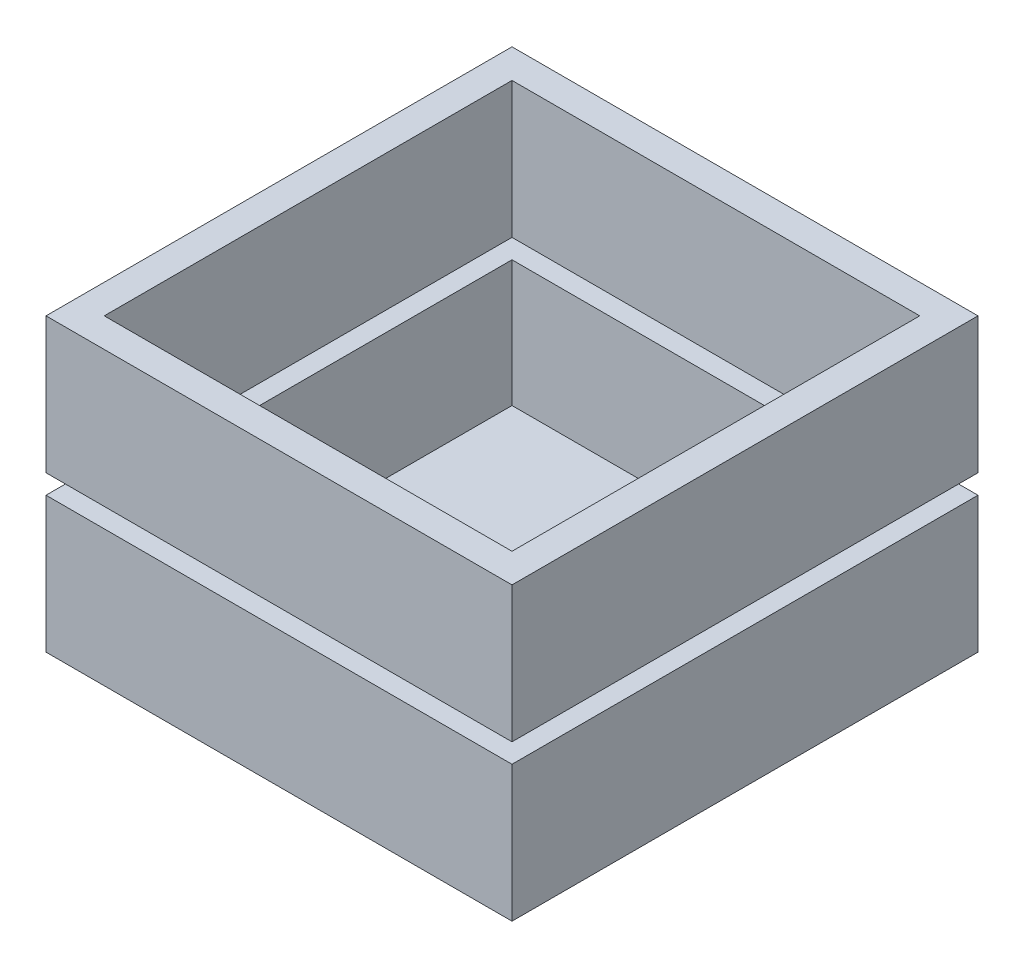
from build123d import *

# Parameters (mm, degrees)
SKETCH1_W           = 304.8
SKETCH1_H           = 304.8
BOSS_EXTRUDE1_DEPTH = 203.2
SHELL1_T            = -19.05
SKETCH2_W           = 304.8
SKETCH2_H           = 12.7
CUT_EXTRUDE1_DEPTH  = 397.760683536


with BuildPart() as part:
    # Sketch1 → Boss-Extrude1 (new body)
    with BuildSketch(Plane(origin=(0, 0, 0), x_dir=(1, 0, 0), z_dir=(0, 1, 0))):
        Rectangle(SKETCH1_W, SKETCH1_H)
    extrude(amount=BOSS_EXTRUDE1_DEPTH)

    # Shell1
    shell1_openings = [part.faces().sort_by_distance(p)[0] for p in [
        (0, 203.2, 0),
    ]]
    offset(amount=SHELL1_T, openings=shell1_openings, kind=Kind.INTERSECTION)

    # Sketch2 → Cut-Extrude1 (cut, through all)
    with BuildSketch(Plane.XY.offset(152.4)):
        with Locations((0, 107.95)):
            Rectangle(SKETCH2_W, SKETCH2_H)
        with Locations((0, 6.35)):
            Rectangle(SKETCH2_W, SKETCH2_H)
    extrude(amount=-CUT_EXTRUDE1_DEPTH, mode=Mode.SUBTRACT)


with BuildPart() as cut_extrude1_piece_1:
    # of the separate pieces the step leaves, piece 1, a body of its own (cut_extrude1_pieces)
    add(part.part.solids().sort_by_distance((152.4, 12.7, -152.4))[0])


with BuildPart() as cut_extrude1_piece_2:
    # of the separate pieces the step leaves, piece 2, a body of its own (cut_extrude1_pieces)
    add(part.part.solids().sort_by_distance((152.4, 114.3, -152.4))[0])


solid = Compound([cut_extrude1_piece_1.part, cut_extrude1_piece_2.part])
